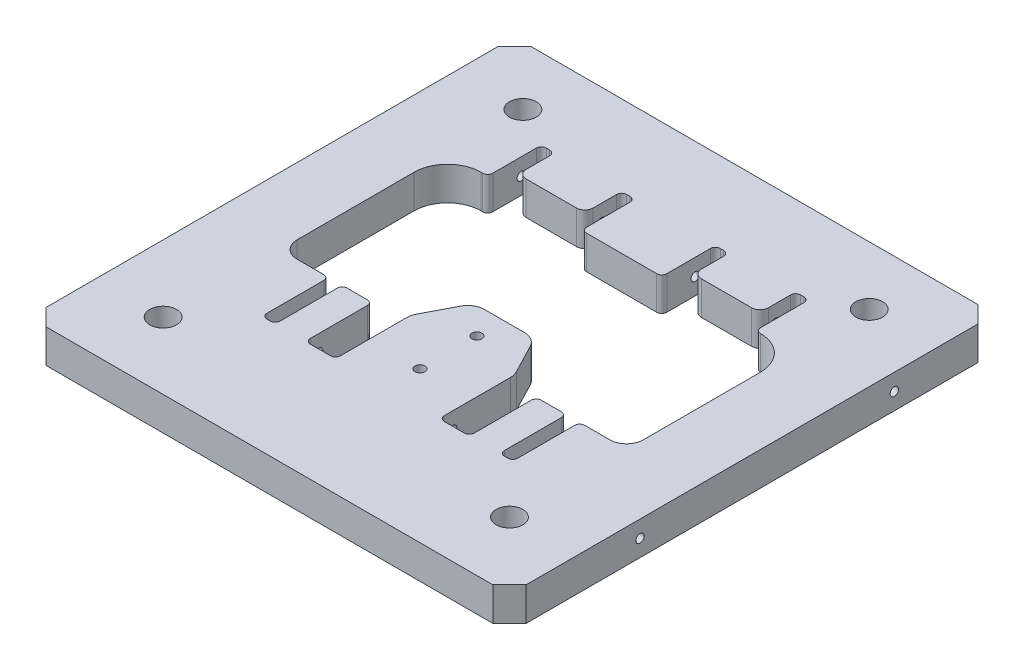
from build123d import *

# Parameters (mm, degrees)
FILLET1_OUTLINE_R     = 8
FILLET1_OUTLINE_R_2   = 7
FILLET1_OUTLINE_R_3   = 1.65
FILLET1_DEPTH         = 20
FILLET1_START         = 11
FILLET1_2_OUTLINE_R   = 7
FILLET1_2_OUTLINE_R_2 = 3
FILLET1_2_OUTLINE_R_3 = 1.65
FILLET1_2_DEPTH       = 9
FILLET1_START_2       = 10
FILLET1_3_OUTLINE_R   = 1.65
FILLET1_3_DEPTH       = 1
FILLET1_START_3       = -1
FILLET1_4_OUTLINE_R   = 2.5
FILLET1_4_DEPTH       = 289
CUT_EXTRUDE1_DEPTH    = 42
FILLET2_R             = 10
SKETCH2_W             = 42.909643268
SKETCH2_H             = 22.925607662
SKETCH2_W_2           = 43.116379367
SKETCH2_H_2           = 35.117017069
CUT_EXTRUDE2_DEPTH    = 42
FILLET3_R             = 5


with BuildPart() as part:
    # Fillet1: read off the stored shape, not the designer's step
    # Fillet1 outline → Fillet1 (new body)
    with BuildSketch(Plane(origin=(0, 0, 0), x_dir=(1, 0, 0), z_dir=(0, 1, 0))):
        Polygon((0, 280), (0, 10), (10, 0), (277, 0), (287, 10), (287, 280), (277, 290), (10, 290), align=None)
        with Locations((40, 40)):
            Circle(FILLET1_OUTLINE_R, mode=Mode.SUBTRACT)
        with Locations((143.495955763, 90)):
            Circle(FILLET1_OUTLINE_R_2, mode=Mode.SUBTRACT)
        with Locations((143.495955763, 124)):
            Circle(FILLET1_OUTLINE_R_2, mode=Mode.SUBTRACT)
        with Locations((247, 40)):
            Circle(FILLET1_OUTLINE_R, mode=Mode.SUBTRACT)
        with Locations((40, 255)):
            Circle(FILLET1_OUTLINE_R, mode=Mode.SUBTRACT)
        with Locations((133.495955763, 219.5)):
            Circle(FILLET1_OUTLINE_R_3, mode=Mode.SUBTRACT)
        with BuildLine():
            Line((237, 110), (222, 110))
            ThreePointArc((222, 110), (219.878679656, 109.121320344), (219, 107))
            Line((219, 107), (219, 73))
            ThreePointArc((219, 73), (218.121320344, 70.878679656), (216, 70))
            Line((216, 70), (214, 70))
            ThreePointArc((214, 70), (211.878679656, 70.878679656), (211, 73))
            Line((211, 73), (211, 107))
            ThreePointArc((211, 107), (210.121320344, 109.121320344), (208, 110))
            Line((208, 110), (196, 110))
            ThreePointArc((196, 110), (193.878679656, 109.121320344), (193, 107))
            Line((193, 107), (193, 73))
            ThreePointArc((193, 73), (192.121320344, 70.878679656), (190, 70))
            Line((190, 70), (178, 70))
            ThreePointArc((178, 70), (175.878679656, 70.878679656), (175, 73))
            Line((175, 73), (175, 137))
            ThreePointArc((175, 137), (174.121320344, 139.121320344), (172, 140))
            Line((172, 140), (116, 140))
            ThreePointArc((116, 140), (113.878679656, 139.121320344), (113, 137))
            Line((113, 137), (113, 73))
            ThreePointArc((113, 73), (112.121320344, 70.878679656), (110, 70))
            Line((110, 70), (98, 70))
            ThreePointArc((98, 70), (95.878679656, 70.878679656), (95, 73))
            Line((95, 73), (95, 107))
            ThreePointArc((95, 107), (94.121320344, 109.121320344), (92, 110))
            Line((92, 110), (80, 110))
            ThreePointArc((80, 110), (77.878679656, 109.121320344), (77, 107))
            Line((77, 107), (77, 73))
            ThreePointArc((77, 73), (76.121320344, 70.878679656), (74, 70))
            Line((74, 70), (72, 70))
            ThreePointArc((72, 70), (69.878679656, 70.878679656), (69, 73))
            Line((69, 73), (69, 107))
            ThreePointArc((69, 107), (68.121320344, 109.121320344), (66, 110))
            Line((66, 110), (50, 110))
            ThreePointArc((50, 110), (42.928932188, 112.928932188), (40, 120))
            Line((40, 120), (40, 190))
            ThreePointArc((40, 190), (45.857864376, 204.142135624), (60, 210))
            Line((60, 210), (61, 210))
            ThreePointArc((61, 210), (63.121320344, 210.878679656), (64, 213))
            Line((64, 213), (64, 239))
            ThreePointArc((64, 239), (64.878679656, 241.121320344), (67, 242))
            Line((67, 242), (69, 242))
            ThreePointArc((69, 242), (71.121320344, 241.121320344), (72, 239))
            Line((72, 239), (72, 213))
            ThreePointArc((72, 213), (72.878679656, 210.878679656), (75, 210))
            Line((75, 210), (109, 210))
            ThreePointArc((109, 210), (111.121320344, 210.878679656), (112, 213))
            Line((112, 213), (112, 239))
            ThreePointArc((112, 239), (112.878679656, 241.121320344), (115, 242))
            Line((115, 242), (117, 242))
            ThreePointArc((117, 242), (119.121320344, 241.121320344), (120, 239))
            Line((120, 239), (120, 213))
            ThreePointArc((120, 213), (120.878679656, 210.878679656), (123, 210))
            Line((123, 210), (165, 210))
            ThreePointArc((165, 210), (167.121320344, 210.878679656), (168, 213))
            Line((168, 213), (168, 239))
            ThreePointArc((168, 239), (168.878679656, 241.121320344), (171, 242))
            Line((171, 242), (173, 242))
            ThreePointArc((173, 242), (175.121320344, 241.121320344), (176, 239))
            Line((176, 239), (176, 213))
            ThreePointArc((176, 213), (176.878679656, 210.878679656), (179, 210))
            Line((179, 210), (213, 210))
            ThreePointArc((213, 210), (215.121320344, 210.878679656), (216, 213))
            Line((216, 213), (216, 239))
            ThreePointArc((216, 239), (216.878679656, 241.121320344), (219, 242))
            Line((219, 242), (221, 242))
            ThreePointArc((221, 242), (223.121320344, 241.121320344), (224, 239))
            Line((224, 239), (224, 213))
            ThreePointArc((224, 213), (224.878679656, 210.878679656), (227, 210))
            ThreePointArc((227, 210), (241.142135624, 204.142135624), (247, 190))
            Line((247, 190), (247, 120))
            ThreePointArc((247, 120), (244.071067812, 112.928932188), (237, 110))
        make_face(mode=Mode.SUBTRACT)
        with Locations((153.495955763, 219.5)):
            Circle(FILLET1_OUTLINE_R_3, mode=Mode.SUBTRACT)
        with Locations((247, 255)):
            Circle(FILLET1_OUTLINE_R, mode=Mode.SUBTRACT)
    extrude(amount=FILLET1_DEPTH)

    # Fillet1 2 outline → Fillet1 2 (add)
    # profile 1 of 4: a face of its own
    with BuildSketch(Plane(origin=(0, 0, 0), x_dir=(1, 0, 0), z_dir=(0, 1, 0)).offset(FILLET1_START)):
        with Locations((143.495955763, 90)):
            Circle(FILLET1_2_OUTLINE_R)
        with Locations((143.495955763, 90)):
            Circle(FILLET1_2_OUTLINE_R_2, mode=Mode.SUBTRACT)
    # profile 2 of 4: a face of its own
    with BuildSketch(Plane(origin=(0, 0, 0), x_dir=(1, 0, 0), z_dir=(0, 1, 0)).offset(FILLET1_START)):
        with Locations((143.495955763, 124)):
            Circle(FILLET1_2_OUTLINE_R)
        with Locations((143.495955763, 124)):
            Circle(FILLET1_2_OUTLINE_R_2, mode=Mode.SUBTRACT)
    # profile 3 of 4: a face of its own
    with BuildSketch(Plane(origin=(0, 0, 0), x_dir=(1, 0, 0), z_dir=(0, 1, 0)).offset(FILLET1_START)):
        with Locations((153.495955763, 219.5)):
            Circle(FILLET1_2_OUTLINE_R_3)
    # profile 4 of 4: a face of its own
    with BuildSketch(Plane(origin=(0, 0, 0), x_dir=(1, 0, 0), z_dir=(0, 1, 0)).offset(FILLET1_START)):
        with Locations((133.495955763, 219.5)):
            Circle(FILLET1_2_OUTLINE_R_3)
    extrude(amount=FILLET1_2_DEPTH)

    # Fillet1 3 outline → Fillet1 3 (add)
    with BuildSketch(Plane(origin=(0, 0, 0), x_dir=(1, 0, 0), z_dir=(0, 1, 0)).offset(FILLET1_START_2)):
        with Locations((153.495955763, 219.5)):
            Circle(FILLET1_3_OUTLINE_R)
        with Locations((133.495955763, 219.5)):
            Circle(FILLET1_3_OUTLINE_R)
    extrude(amount=FILLET1_3_DEPTH)

    # Fillet1 4 outline → Fillet1 4 (cut)
    with BuildSketch(Plane.YZ.offset(FILLET1_START_3)):
        with Locations((10, -77.99)):
            Circle(FILLET1_4_OUTLINE_R)
        with Locations((10, -229.99)):
            Circle(FILLET1_4_OUTLINE_R)
    extrude(amount=FILLET1_4_DEPTH, mode=Mode.SUBTRACT)

    # Sketch1 → Cut-Extrude1 (cut)
    with BuildSketch(Plane(origin=(0, 20, 0), x_dir=(1, 0, 0), z_dir=(0, 1, 0))):
        Polygon((113, 115), (126, 140), (126, 142.938588866), (102.686400204, 142.938588866), (102.686400204, 115), align=None)
        Polygon((175, 115), (162, 140), (162, 142.938588866), (181.775389982, 142.938588866), (181.775389982, 115), align=None)
    extrude(amount=-CUT_EXTRUDE1_DEPTH, mode=Mode.SUBTRACT)

    # Fillet2
    fillet2_edges = [part.edges().sort_by_distance(p)[0] for p in [
        (113, 10, -115),
        (175, 10, -115),
        (126, 10, -140),
        (162, 10, -140),
    ]]
    fillet(fillet2_edges, radius=FILLET2_R)

    # Sketch2 → Cut-Extrude2 (cut)
    with BuildSketch(Plane(origin=(0, 20, 0), x_dir=(1, 0, 0), z_dir=(0, 1, 0))):
        with Locations((93.454821634, 208.537196169)):
            Rectangle(SKETCH2_W, SKETCH2_H)
        with Locations((197.558189684, 203.14602613)):
            Rectangle(SKETCH2_W_2, SKETCH2_H_2)
    extrude(amount=-CUT_EXTRUDE2_DEPTH, mode=Mode.SUBTRACT)

    # Fillet3
    fillet3_edges = [part.edges().sort_by_distance(p)[0] for p in [
        (112, 10, -220),
        (72, 10, -220),
        (176, 10, -220.704534665),
        (216, 10, -220.704534665),
    ]]
    fillet(fillet3_edges, radius=FILLET3_R)


solid = part.part
